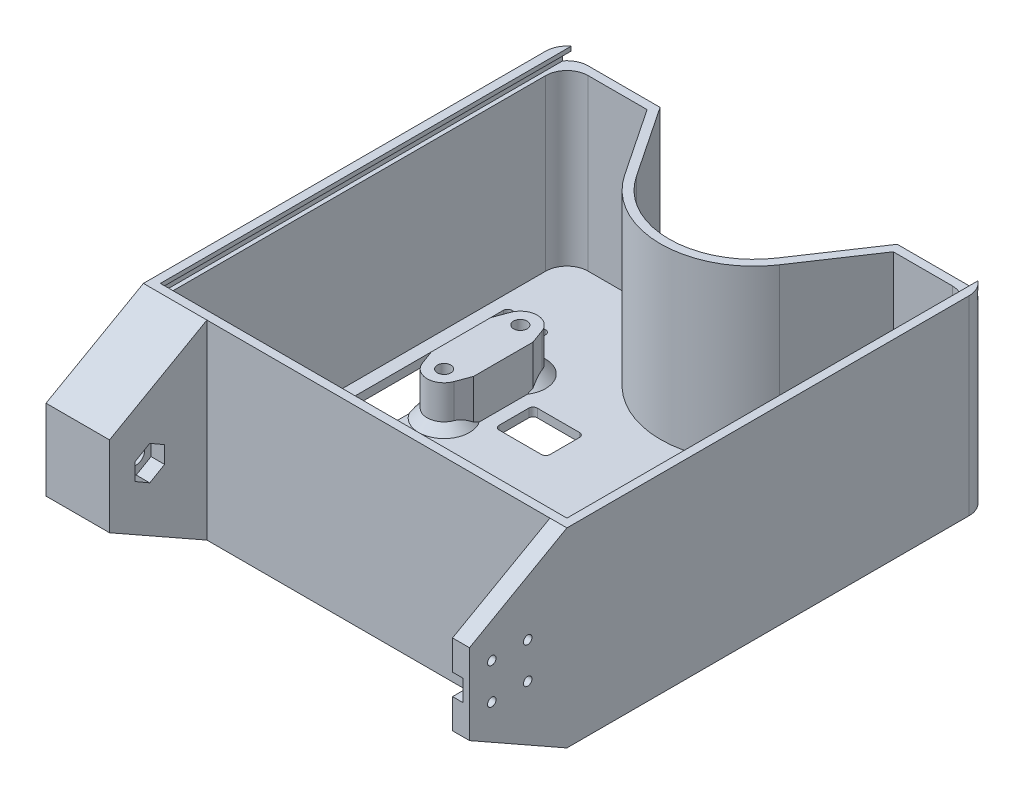
from build123d import *

# Parameters (mm, degrees)
AUFSATZ_LINEAR_AUSTRAGEN1_DEPTH  = 45
WANDUNG1_T                       = -2
SKIZZE1_W                        = 10
SKIZZE1_H                        = 42
SCHNITT_LINEAR_AUSTRAGEN1_DEPTH  = 2
SKIZZE2_R                        = 1.6
AUFSATZ_LINEAR_AUSTRAGEN2_DEPTH  = 10
VERRUNDUNG1_R                    = 1
SKIZZE6_R                        = 1.6
SCHNITT_LINEAR_AUSTRAGEN2_DEPTH  = 79.0320447
SCHNITT_LINEAR_AUSTRAGEN3_DEPTH  = 9
FASE1_SIZE                       = 2
SKIZZE8_W                        = 12
SKIZZE8_H                        = 9
SCHNITT_LINEAR_AUSTRAGEN4_DEPTH  = 2
VERRUNDUNG2_R                    = 1
VERRUNDUNG3_R                    = 5
VERRUNDUNG4_R                    = 5
SCHNITT_LINEAR_AUSTRAGEN5_REACH  = 85.815
SKIZZE14_W                       = 15
SKIZZE14_H                       = 45
SKIZZE14_W_2                     = 4
AUFSATZ_LINEAR_AUSTRAGEN5_DEPTH  = 23
SKIZZE18_R                       = 1
SCHNITT_LINEAR_AUSTRAGEN8_DEPTH  = 4
SCHNITT_LINEAR_AUSTRAGEN9_DEPTH  = 2.5
SKIZZE20_W                       = 5
SKIZZE20_H                       = 10
SCHNITT_LINEAR_AUSTRAGEN10_DEPTH = 2
SKIZZE21_R                       = 2
SCHNITT_LINEAR_AUSTRAGEN11_DEPTH = 15
SCHNITT_LINEAR_AUSTRAGEN14_DEPTH = 3.2
SCHNITT_LINEAR_AUSTRAGEN15_REACH = 133.735
SKIZZE31_W                       = 96
SKIZZE31_H                       = 3
SCHNITT_LINEAR_AUSTRAGEN16_DEPTH = 30
SKIZZE32_W                       = 98
SKIZZE32_H                       = 2
SCHNITT_LINEAR_AUSTRAGEN17_DEPTH = 99
SCHNITT_LINEAR_AUSTRAGEN18_REACH = 133.735
AUFSATZ_LINEAR_AUSTRAGEN6_DEPTH  = 12
AUFSATZ_LINEAR_AUSTRAGEN7_DEPTH  = 2
SKIZZE36_R                       = 1.6
SCHNITT_LINEAR_AUSTRAGEN19_DEPTH = 2
FASE2_SIZE                       = 2
SKIZZE23_R                       = 4
SCHNITT_LINEAR_AUSTRAGEN20_DEPTH = 2
SCHNITT_LINEAR_AUSTRAGEN20_DRAFT = -45


with BuildPart() as part:
    # Grundplatte → Aufsatz-Linear austragen1 (new body)
    with BuildSketch(Plane(origin=(0, 0, 0), x_dir=(1, 0, 0), z_dir=(0, 1, 0))):
        with BuildLine():
            Line((-50, 50), (-50, -50))
            Line((-50, -50), (50, -50))
            Line((50, -50), (50, 50))
            Line((50, 50), (28, 50))
            Line((28, 50), (16.61985221, 33))
            ThreePointArc((16.61985221, 33), (0, 24.125669082), (-16.61985221, 33))
            Line((-16.61985221, 33), (-28, 50))
            Line((-28, 50), (-50, 50))
        make_face()
    extrude(amount=AUFSATZ_LINEAR_AUSTRAGEN1_DEPTH)

    # Wandung1
    wandung1_openings = [part.faces().sort_by_distance(p)[0] for p in [
        (0, 45, 4.219695438),
    ]]
    offset(amount=WANDUNG1_T, openings=wandung1_openings, kind=Kind.INTERSECTION)

    # Skizze1 → Schnitt-Linear austragen1 (cut)
    with BuildSketch(Plane(origin=(0, 2, 0), x_dir=(1, 0, 0), z_dir=(0, 1, 0))):
        with Locations((-40, 10)):
            Rectangle(SKIZZE1_W, SKIZZE1_H)
        with Locations((40, 10)):
            Rectangle(SKIZZE1_W, SKIZZE1_H)
    extrude(amount=-SCHNITT_LINEAR_AUSTRAGEN1_DEPTH, mode=Mode.SUBTRACT)

    # Skizze2 → Aufsatz-Linear austragen2 (add)
    # profile 1 of 2: a face of its own
    with BuildSketch(Plane(origin=(0, 2, 0), x_dir=(1, 0, 0), z_dir=(0, 1, 0))):
        with BuildLine():
            Line((-35, 16), (-35, 4))
            Line((-35, 4), (-35, 3))
            Line((-35, 3), (-33.753255524, -0.383138811))
            ThreePointArc((-33.753255524, -0.383138811), (-30, -3), (-26.246744476, -0.383138811))
            Line((-26.246744476, -0.383138811), (-25, 3))
            Line((-25, 3), (-25, 4))
            Line((-25, 4), (-25, 16))
            Line((-25, 16), (-25, 17))
            Line((-25, 17), (-26.246744476, 20.383138811))
            ThreePointArc((-26.246744476, 20.383138811), (-30, 23), (-33.753255524, 20.383138811))
            Line((-33.753255524, 20.383138811), (-35, 17))
            Line((-35, 17), (-35, 16))
        make_face()
        with Locations(Location((-30, 19, 0), (0, 0, 270))):
            Circle(SKIZZE2_R, mode=Mode.SUBTRACT)
        with Locations(Location((-30, 1, 0), (0, 0, 270))):
            Circle(SKIZZE2_R, mode=Mode.SUBTRACT)
    # profile 2 of 2: a face of its own
    with BuildSketch(Plane(origin=(0, 2, 0), x_dir=(1, 0, 0), z_dir=(0, 1, 0))):
        with BuildLine():
            Line((35, 16), (35, 17))
            Line((35, 17), (33.753255524, 20.383138811))
            ThreePointArc((33.753255524, 20.383138811), (30, 23), (26.246744476, 20.383138811))
            Line((26.246744476, 20.383138811), (25, 17))
            Line((25, 17), (25, 16))
            Line((25, 16), (25, 4))
            Line((25, 4), (25, 3))
            Line((25, 3), (26.246744476, -0.383138811))
            ThreePointArc((26.246744476, -0.383138811), (30, -3), (33.753255524, -0.383138811))
            Line((33.753255524, -0.383138811), (35, 3))
            Line((35, 3), (35, 4))
            Line((35, 4), (35, 16))
        make_face()
        with Locations(Location((30, 1, 0), (0, 0, 90))):
            Circle(SKIZZE2_R, mode=Mode.SUBTRACT)
        with Locations(Location((30, 19, 0), (0, 0, 90))):
            Circle(SKIZZE2_R, mode=Mode.SUBTRACT)
    extrude(amount=AUFSATZ_LINEAR_AUSTRAGEN2_DEPTH)

    # Verrundung1
    verrundung1_edges = [part.edges().sort_by_distance(p)[0] for p in [
        (-35, 1, -31),
        (-35, 1, 11),
        (-45, 1, 11),
        (-45, 1, -31),
        (45, 1, -31),
        (45, 1, 11),
        (35, 1, 11),
        (35, 1, -31),
    ]]
    fillet(verrundung1_edges, radius=VERRUNDUNG1_R)

    # Skizze6 → Schnitt-Linear austragen2 (cut, through all)
    with BuildSketch(Plane(origin=(0, 12, 0), x_dir=(1, 0, 0), z_dir=(0, 1, 0))):
        with Locations(Location((-30, 19, 0), (0, 0, 270))):
            Circle(SKIZZE6_R)
        with Locations(Location((-30, 1, 0), (0, 0, 270))):
            Circle(SKIZZE6_R)
        with Locations(Location((30, 19, 0), (0, 0, 90))):
            Circle(SKIZZE6_R)
        with Locations(Location((30, 1, 0), (0, 0, 90))):
            Circle(SKIZZE6_R)
    extrude(amount=-SCHNITT_LINEAR_AUSTRAGEN2_DEPTH, mode=Mode.SUBTRACT)

    # Skizze7 → Schnitt-Linear austragen3 (cut)
    with BuildSketch(Plane.XZ):
        Polygon((-26.709103466, -1), (-28.354551733, 1.85), (-31.645448267, 1.85), (-33.290896534, -1), (-31.645448267, -3.85), (-28.354551733, -3.85), align=None)
        Polygon((28.354551733, -21.85), (26.709103466, -19), (28.354551733, -16.15), (31.645448267, -16.15), (33.290896534, -19), (31.645448267, -21.85), align=None)
        Polygon((-26.709103466, -19), (-28.354551733, -16.15), (-31.645448267, -16.15), (-33.290896534, -19), (-31.645448267, -21.85), (-28.354551733, -21.85), align=None)
        Polygon((28.354551733, -3.85), (26.709103466, -1), (28.354551733, 1.85), (31.645448267, 1.85), (33.290896534, -1), (31.645448267, -3.85), align=None)
    extrude(amount=-SCHNITT_LINEAR_AUSTRAGEN3_DEPTH, mode=Mode.SUBTRACT)

    # Fase1
    # the kernel refuses this chamfer: 2 mm, written as the material it adds along each edge
    with BuildSketch(Plane(origin=(33.753255524, 2, 0.383138811), x_dir=(0.9379591204561566, -0.02749587661058633, 0.3456539673177909), z_dir=(0.3457847026662013, 0, -0.9383138810664834))) as fase1_piece_1_section:
        Polygon((FASE1_SIZE * 0.999621916911, -FASE1_SIZE * 0.0274958766106), (-FASE1_SIZE * 0.0274958766106, -FASE1_SIZE * 0.999621916911), (0, 0), align=None)
    fase1_piece_1 = extrude(amount=8.748917251, mode=Mode.PRIVATE)
    fase1_piece_1 = split(fase1_piece_1, bisect_by=Plane(origin=(35, 2.810043693, -0.69339811), z_dir=(-1, 0, 0)), keep=Keep.TOP, mode=Mode.PRIVATE)
    add(fase1_piece_1)
    with BuildSketch(Plane(origin=(30, 2, -1), x_dir=(-0.5946157089023157, 0, -0.8040100488965276), z_dir=(0.8040100488965276, 0, -0.5946157089023157))) as fase1_piece_2_section:
        Polygon((4 + FASE1_SIZE, 0), (4, FASE1_SIZE), (4, 0), align=None)
    fase1_piece_2 = revolve(axis=Axis((30, 2, -1), (0, 1, 0)), revolution_arc=213.285054007, mode=Mode.PRIVATE)
    fase1_piece_2 = split(fase1_piece_2, bisect_by=Plane(origin=(35, 2.618842305, 0.921149391), z_dir=(-1, 0, 0)), keep=Keep.TOP, mode=Mode.PRIVATE)
    add(fase1_piece_2)
    with BuildSketch(Plane(origin=(36.778497275, 2, -12.173908309), x_dir=(0.937959120456157, -0.027495876610586348, -0.34565396731779), z_dir=(-0.34578470266620037, 0, -0.9383138810664838))) as fase1_piece_3_section:
        Polygon((FASE1_SIZE * 0.999621916911, -FASE1_SIZE * 0.0274958766106), (-FASE1_SIZE * 0.0274958766106, -FASE1_SIZE * 0.999621916911), (0, 0), align=None)
    fase1_piece_3 = extrude(amount=8.748917251, mode=Mode.PRIVATE)
    fase1_piece_3 = split(fase1_piece_3, bisect_by=Plane(origin=(35, 2.810043693, -19.30660189), z_dir=(-1, 0, 0)), keep=Keep.TOP, mode=Mode.PRIVATE)
    add(fase1_piece_3)
    with BuildSketch(Plane(origin=(30, 2, -19), x_dir=(0.9383138810664835, 0, -0.3457847026662016), z_dir=(0.3457847026662016, 0, 0.9383138810664835))) as fase1_piece_4_section:
        Polygon((4 + FASE1_SIZE, 0), (4, FASE1_SIZE), (4, 0), align=None)
    fase1_piece_4 = revolve(axis=Axis((30, 2, -19), (0, 1, 0)), revolution_arc=213.285054007, mode=Mode.PRIVATE)
    fase1_piece_4 = split(fase1_piece_4, bisect_by=Plane(origin=(35, 2.568302244, -21.912371656), z_dir=(-1, 0, 0)), keep=Keep.TOP, mode=Mode.PRIVATE)
    add(fase1_piece_4)
    with BuildSketch(Plane(origin=(-33.753255524, 2, -20.383138811), x_dir=(-0.9379591204561563, -0.02749587661058632, -0.34565396731779174), z_dir=(-0.34578470266620215, 0, 0.9383138810664832))) as fase1_piece_5_section:
        Polygon((FASE1_SIZE * 0.999621916911, -FASE1_SIZE * 0.0274958766106), (-FASE1_SIZE * 0.0274958766106, -FASE1_SIZE * 0.999621916911), (0, 0), align=None)
    fase1_piece_5 = extrude(amount=8.748917251, mode=Mode.PRIVATE)
    fase1_piece_5 = split(fase1_piece_5, bisect_by=Plane(origin=(-35, 2.810043693, -19.30660189), z_dir=(1, 0, 0)), keep=Keep.TOP, mode=Mode.PRIVATE)
    add(fase1_piece_5)
    with BuildSketch(Plane(origin=(-30, 2, -19), x_dir=(0.5946157089023089, 0, 0.8040100488965327), z_dir=(-0.8040100488965327, 0, 0.5946157089023089))) as fase1_piece_6_section:
        Polygon((4 + FASE1_SIZE, 0), (4, FASE1_SIZE), (4, 0), align=None)
    fase1_piece_6 = revolve(axis=Axis((-30, 2, -19), (0, 1, 0)), revolution_arc=213.285054007, mode=Mode.PRIVATE)
    fase1_piece_6 = split(fase1_piece_6, bisect_by=Plane(origin=(-35, 2.618842305, -20.921149391), z_dir=(1, 0, 0)), keep=Keep.TOP, mode=Mode.PRIVATE)
    add(fase1_piece_6)
    with BuildSketch(Plane(origin=(-36.778497275, 2, -7.826091691), x_dir=(-0.937959120456156, -0.02749587661058632, 0.3456539673177927), z_dir=(0.3457847026662031, 0, 0.9383138810664828))) as fase1_piece_7_section:
        Polygon((FASE1_SIZE * 0.999621916911, -FASE1_SIZE * 0.0274958766106), (-FASE1_SIZE * 0.0274958766106, -FASE1_SIZE * 0.999621916911), (0, 0), align=None)
    fase1_piece_7 = extrude(amount=8.748917251, mode=Mode.PRIVATE)
    fase1_piece_7 = split(fase1_piece_7, bisect_by=Plane(origin=(-35, 2.810043693, -0.69339811), z_dir=(1, 0, 0)), keep=Keep.TOP, mode=Mode.PRIVATE)
    add(fase1_piece_7)
    with BuildSketch(Plane(origin=(-30, 2, -1), x_dir=(-0.9383138810664808, 0, 0.34578470266620803), z_dir=(-0.34578470266620803, 0, -0.9383138810664808))) as fase1_piece_8_section:
        Polygon((4 + FASE1_SIZE, 0), (4, FASE1_SIZE), (4, 0), align=None)
    fase1_piece_8 = revolve(axis=Axis((-30, 2, -1), (0, 1, 0)), revolution_arc=213.285054007, mode=Mode.PRIVATE)
    fase1_piece_8 = split(fase1_piece_8, bisect_by=Plane(origin=(-35, 2.568302244, 1.912371656), z_dir=(1, 0, 0)), keep=Keep.TOP, mode=Mode.PRIVATE)
    add(fase1_piece_8)

    # Skizze8 → Schnitt-Linear austragen4 (cut)
    with BuildSketch(Plane.XZ):
        with Locations((16, -9.5)):
            Rectangle(SKIZZE8_W, SKIZZE8_H)
        with Locations((-16, -9.5)):
            Rectangle(SKIZZE8_W, SKIZZE8_H)
    extrude(amount=-SCHNITT_LINEAR_AUSTRAGEN4_DEPTH, mode=Mode.SUBTRACT)

    # Verrundung2
    verrundung2_edges = [part.edges().sort_by_distance(p)[0] for p in [
        (-10, 1, -14),
        (-10, 1, -5),
        (-22, 1, -5),
        (-22, 1, -14),
        (10, 1, -5),
        (10, 1, -14),
        (22, 1, -14),
        (22, 1, -5),
    ]]
    fillet(verrundung2_edges, radius=VERRUNDUNG2_R)

    # Verrundung3
    verrundung3_edges = [part.edges().sort_by_distance(p)[0] for p in [
        (-50, 22.5, -50),
        (50, 22.5, -50),
    ]]
    fillet(verrundung3_edges, radius=VERRUNDUNG3_R)

    # Verrundung4
    verrundung4_edges = [part.edges().sort_by_distance(p)[0] for p in [
        (48, 23.5, -48),
        (-48, 23.5, -48),
    ]]
    fillet(verrundung4_edges, radius=VERRUNDUNG4_R)

    # Skizze9 → Schnitt-Linear austragen5 (cut, up to next)
    with BuildSketch(Plane.XZ, mode=Mode.PRIVATE) as schnitt_linear_austragen5_sk1:
        with BuildLine():
            Line((-10.8, 43), (10.8, 43))
            ThreePointArc((10.8, 43), (11.648528137, 42.648528137), (12, 41.8))
            Line((12, 41.8), (12, 28.2))
            ThreePointArc((12, 28.2), (11.648528137, 27.351471863), (10.8, 27))
            Line((10.8, 27), (-10.8, 27))
            ThreePointArc((-10.8, 27), (-11.648528137, 27.351471863), (-12, 28.2))
            Line((-12, 28.2), (-12, 41.8))
            ThreePointArc((-12, 41.8), (-11.648528137, 42.648528137), (-10.8, 43))
        make_face()
    schnitt_linear_austragen5_tool1 = extrude(schnitt_linear_austragen5_sk1.sketch, amount=-SCHNITT_LINEAR_AUSTRAGEN5_REACH, mode=Mode.PRIVATE) & part.part
    add(schnitt_linear_austragen5_tool1.solids().sort_by_distance((0, 0, 35))[0], mode=Mode.SUBTRACT)

    # Skizze14 → Aufsatz-Linear austragen5 (add)
    with BuildSketch(Plane.XY.offset(50)):
        with Locations((-42.5, 22.5)):
            Rectangle(SKIZZE14_W, SKIZZE14_H)
        with Locations((48, 22.5)):
            Rectangle(SKIZZE14_W_2, SKIZZE14_H)
    extrude(amount=AUFSATZ_LINEAR_AUSTRAGEN5_DEPTH)

    # Skizze18 → Schnitt-Linear austragen8 (cut)
    with BuildSketch(Plane(origin=(50, 0, 0), x_dir=(0, 0, -1), z_dir=(1, 0, 0))):
        with Locations((-59.257359313, 18.257359313)):
            Circle(SKIZZE18_R)
        with Locations((-67.742640687, 18.257359313)):
            Circle(SKIZZE18_R)
        with Locations((-67.742640687, 26.742640687)):
            Circle(SKIZZE18_R)
        with Locations((-59.257359313, 26.742640687)):
            Circle(SKIZZE18_R)
    extrude(amount=-SCHNITT_LINEAR_AUSTRAGEN8_DEPTH, mode=Mode.SUBTRACT)

    # Skizze19 → Schnitt-Linear austragen9 (cut)
    with BuildSketch(Plane.ZY.offset(-46)):
        with BuildLine():
            Line((63.5, 25), (73, 25))
            Line((73, 25), (73, 20))
            Line((73, 20), (63.5, 20))
            ThreePointArc((63.5, 20), (61, 22.5), (63.5, 25))
        make_face()
    extrude(amount=-SCHNITT_LINEAR_AUSTRAGEN9_DEPTH, mode=Mode.SUBTRACT)

    # Skizze20 → Schnitt-Linear austragen10 (cut)
    with BuildSketch(Plane.XY.offset(50)):
        with Locations((43.5, 22.5)):
            Rectangle(SKIZZE20_W, SKIZZE20_H)
    extrude(amount=-SCHNITT_LINEAR_AUSTRAGEN10_DEPTH, mode=Mode.SUBTRACT)

    # Skizze21 → Schnitt-Linear austragen11 (cut)
    with BuildSketch(Plane.ZY.offset(50)):
        with Locations((63.5, 22.5)):
            Circle(SKIZZE21_R)
    extrude(amount=-SCHNITT_LINEAR_AUSTRAGEN11_DEPTH, mode=Mode.SUBTRACT)

    # Skizze26 → Schnitt-Linear austragen14 (cut)
    with BuildSketch(Plane(origin=(-35, 0, 0), x_dir=(0, 0, -1), z_dir=(1, 0, 0))):
        Polygon((-60, 20.479274058), (-60, 24.520725942), (-63.5, 26.541451884), (-67, 24.520725942), (-67, 20.479274058), (-63.5, 18.458548116), align=None)
    extrude(amount=-SCHNITT_LINEAR_AUSTRAGEN14_DEPTH, mode=Mode.SUBTRACT)

    # Schnitt-Linear austragen15: up to this face of the body (flat: up to its plane)
    schnitt_linear_austragen15_end = Plane(part.part.faces().sort_by_distance((50, 22.5, 13.882577982))[0])
    # Skizze29 → Schnitt-Linear austragen15 (cut, up to the picked face)
    with BuildSketch(Plane.ZY.offset(50), mode=Mode.PRIVATE) as schnitt_linear_austragen15_sk1:
        Polygon((73, 45), (73, 32), (50, 45), align=None)
    schnitt_linear_austragen15_tool1 = split(extrude(schnitt_linear_austragen15_sk1.sketch, amount=-SCHNITT_LINEAR_AUSTRAGEN15_REACH, mode=Mode.PRIVATE), bisect_by=schnitt_linear_austragen15_end, keep=Keep.BOTH, mode=Mode.PRIVATE)
    add(schnitt_linear_austragen15_tool1.solids().sort_by(Axis((-50, 40.666667, 65.333333), (1, 0, 0)))[0], mode=Mode.SUBTRACT)

    # Skizze31 → Schnitt-Linear austragen16 (cut)
    with BuildSketch(Plane(origin=(0, 0, -50), x_dir=(-1, 0, 0), z_dir=(0, 0, -1))):
        with Locations((0, 43.5)):
            Rectangle(SKIZZE31_W, SKIZZE31_H)
    extrude(amount=-SCHNITT_LINEAR_AUSTRAGEN16_DEPTH, mode=Mode.SUBTRACT)

    # Skizze32 → Schnitt-Linear austragen17 (cut)
    with BuildSketch(Plane(origin=(0, 0, -50), x_dir=(-1, 0, 0), z_dir=(0, 0, -1))):
        with Locations((0, 43)):
            Rectangle(SKIZZE32_W, SKIZZE32_H)
    extrude(amount=-SCHNITT_LINEAR_AUSTRAGEN17_DEPTH, mode=Mode.SUBTRACT)

    # Schnitt-Linear austragen18: up to this face of the body (flat: up to its plane)
    schnitt_linear_austragen18_end = Plane(part.part.faces().sort_by_distance((-50, 21.972425858, 12.388407995))[0])
    # Skizze33 → Schnitt-Linear austragen18 (cut, up to the picked face)
    with BuildSketch(Plane(origin=(50, 0, 0), x_dir=(0, 0, -1), z_dir=(1, 0, 0)), mode=Mode.PRIVATE) as schnitt_linear_austragen18_sk1:
        Polygon((-50, 0), (-73, 13), (-73, 0), align=None)
    schnitt_linear_austragen18_tool1 = split(extrude(schnitt_linear_austragen18_sk1.sketch, amount=-SCHNITT_LINEAR_AUSTRAGEN18_REACH, mode=Mode.PRIVATE), bisect_by=schnitt_linear_austragen18_end, keep=Keep.BOTH, mode=Mode.PRIVATE)
    add(schnitt_linear_austragen18_tool1.solids().sort_by(Axis((50, 4.333333, 65.333333), (-1, 0, 0)))[0], mode=Mode.SUBTRACT)

    # Skizze34 → Aufsatz-Linear austragen6 (add)
    with BuildSketch(Plane(origin=(0, 2, 0), x_dir=(1, 0, 0), z_dir=(0, 1, 0))):
        with BuildLine():
            Line((14, -41.8), (14, -28.2))
            ThreePointArc((14, -28.2), (13.0627417, -25.9372583), (10.8, -25))
            Line((10.8, -25), (-10.8, -25))
            ThreePointArc((-10.8, -25), (-13.0627417, -25.9372583), (-14, -28.2))
            Line((-14, -28.2), (-14, -41.8))
            ThreePointArc((-14, -41.8), (-13.0627417, -44.0627417), (-10.8, -45))
            Line((-10.8, -45), (10.8, -45))
            ThreePointArc((10.8, -45), (13.0627417, -44.0627417), (14, -41.8))
        make_face()
        with BuildLine():
            Line((10.8, -27), (-10.8, -27))
            ThreePointArc((-10.8, -27), (-11.648528137, -27.351471863), (-12, -28.2))
            Line((-12, -28.2), (-12, -41.8))
            ThreePointArc((-12, -41.8), (-11.648528137, -42.648528137), (-10.8, -43))
            Line((-10.8, -43), (10.8, -43))
            ThreePointArc((10.8, -43), (11.648528137, -42.648528137), (12, -41.8))
            Line((12, -41.8), (12, -28.2))
            ThreePointArc((12, -28.2), (11.648528137, -27.351471863), (10.8, -27))
        make_face(mode=Mode.SUBTRACT)
    extrude(amount=AUFSATZ_LINEAR_AUSTRAGEN6_DEPTH)

    # Skizze35 → Aufsatz-Linear austragen7 (add)
    with BuildSketch(Plane(origin=(0, 14, 0), x_dir=(1, 0, 0), z_dir=(0, 1, 0))):
        with BuildLine():
            Line((14, -41.8), (14, -28.2))
            ThreePointArc((14, -28.2), (13.0627417, -25.9372583), (10.8, -25))
            Line((10.8, -25), (-10.8, -25))
            ThreePointArc((-10.8, -25), (-13.0627417, -25.9372583), (-14, -28.2))
            Line((-14, -28.2), (-14, -41.8))
            ThreePointArc((-14, -41.8), (-13.0627417, -44.0627417), (-10.8, -45))
            Line((-10.8, -45), (10.8, -45))
            ThreePointArc((10.8, -45), (13.0627417, -44.0627417), (14, -41.8))
        make_face()
    extrude(amount=AUFSATZ_LINEAR_AUSTRAGEN7_DEPTH)

    # Skizze36 → Schnitt-Linear austragen19 (cut)
    with BuildSketch(Plane(origin=(0, 16, 0), x_dir=(1, 0, 0), z_dir=(0, 1, 0))):
        with Locations(Location((8, -35, 0), (0, 0, 270))):
            Circle(SKIZZE36_R)
        with Locations(Location((-8, -35, 0), (0, 0, 270))):
            Circle(SKIZZE36_R)
    extrude(amount=-SCHNITT_LINEAR_AUSTRAGEN19_DEPTH, mode=Mode.SUBTRACT)

    # Fase2
    fase2_edges = [part.edges().sort_by_distance(p)[0] for p in [
        (13.0627417, 2, 25.9372583),
        (0, 2, 25),
        (-13.0627417, 2, 25.9372583),
        (-14, 2, 35),
        (-13.0627417, 2, 44.0627417),
        (0, 2, 45),
        (13.0627417, 2, 44.0627417),
        (14, 2, 35),
    ]]
    chamfer(fase2_edges, length=FASE2_SIZE)


with BuildPart() as schnitt_linear_austragen20_tool:
    # Skizze23 → Schnitt-Linear austragen20 (with draft: the straight prism first)
    with BuildSketch(Plane.ZY.offset(50)):
        with Locations((63.5, 22.5)):
            Circle(SKIZZE23_R)
    extrude(amount=-SCHNITT_LINEAR_AUSTRAGEN20_DEPTH)
    # Schnitt-Linear austragen20: the draft: its side faces are tilted about the plane it starts from
    schnitt_linear_austragen20_sides = [schnitt_linear_austragen20_tool.faces().sort_by_distance(p)[0] for p in [
        (-49, 22.5, 59.5),
    ]]
    draft(schnitt_linear_austragen20_sides, Plane.ZY.offset(50), SCHNITT_LINEAR_AUSTRAGEN20_DRAFT)


with BuildPart() as part_1:
    add(part.part)

    # Schnitt-Linear austragen20: cut by schnitt_linear_austragen20_tool
    add(schnitt_linear_austragen20_tool.part, mode=Mode.SUBTRACT)


solid = part_1.part
